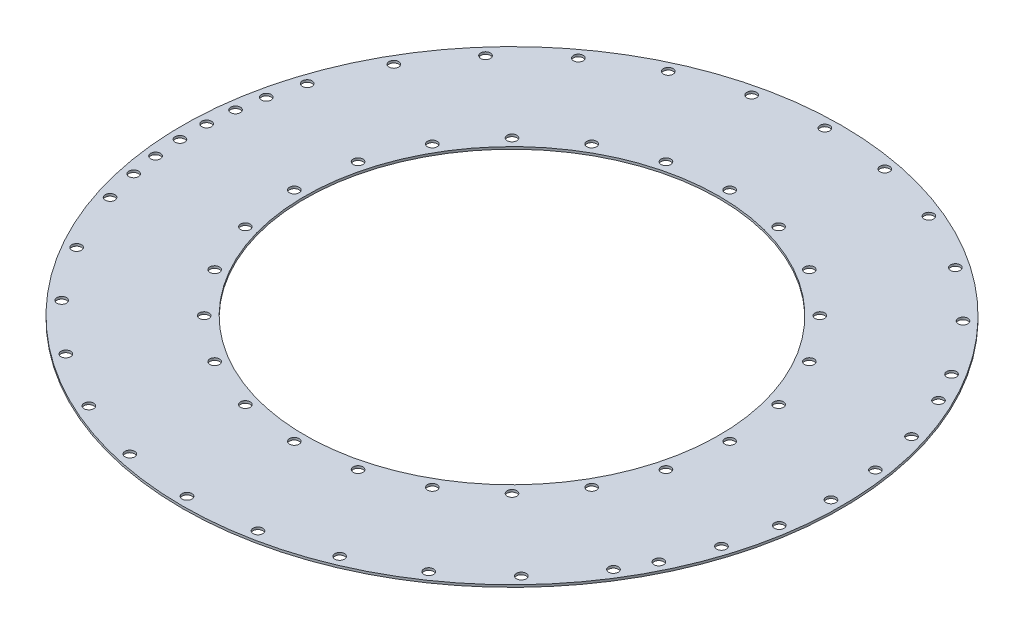
from build123d import *

# Parameters (mm, degrees)
SKETCH1_W             = 40.5
SKETCH1_H             = 0.76
SKETCH2_R             = 1.6
CUT_EXTRUDE1_DEPTH    = 155.151151796
CIRPATTERN1_START     = 6.175
CIRPATTERN1_OUTLINE_R = 1.6
CIRPATTERN1_DEPTH     = 0.76
SKETCH4_R             = 1.6
CUT_EXTRUDE3_DEPTH    = 155.151151796


# Read off the part's stored shape, not the designer's step: CirPattern1
with BuildPart() as part:
    # Sketch1 → Revolve1 (revolve)
    with BuildSketch(Plane.XY, mode=Mode.PRIVATE) as revolve1_sk:
        with Locations((-88.75, 6.555)):
            Rectangle(SKETCH1_W, SKETCH1_H)
    revolve(revolve1_sk.sketch.rotate(Axis((0, -200069.047495165, 0), (0, 1, 0)), 270), axis=Axis((0, -200069.047495165, 0), (0, 1, 0)))

    # Sketch2 → Cut-Extrude1 (cut, through all)
    with BuildSketch(Plane(origin=(0, 6.935, 0), x_dir=(1, 0, 0), z_dir=(0, 1, 0))):
        with Locations(Location((0, 72, 0), (0, 0, 270))):
            Circle(SKETCH2_R)
    extrude(amount=-CUT_EXTRUDE1_DEPTH, mode=Mode.SUBTRACT)

    # CirPattern1 outline → CirPattern1 (cut)
    with BuildSketch(Plane(origin=(0, 0, 0), x_dir=(1, 0, 0), z_dir=(0, 1, 0)).offset(CIRPATTERN1_START)):
        with Locations((18.634971247, 69.546659493)):
            Circle(CIRPATTERN1_OUTLINE_R)
        with Locations((-18.634971247, 69.546659493)):
            Circle(CIRPATTERN1_OUTLINE_R)
        with Locations((-36, 62.353829072)):
            Circle(CIRPATTERN1_OUTLINE_R)
        with Locations((-50.911688245, 50.911688245)):
            Circle(CIRPATTERN1_OUTLINE_R)
        with Locations((-62.353829072, 36)):
            Circle(CIRPATTERN1_OUTLINE_R)
        with Locations((-69.546659493, 18.634971247)):
            Circle(CIRPATTERN1_OUTLINE_R)
        with Locations((-72, 0)):
            Circle(CIRPATTERN1_OUTLINE_R)
        with Locations((36, 62.353829072)):
            Circle(CIRPATTERN1_OUTLINE_R)
        with Locations((50.911688245, 50.911688245)):
            Circle(CIRPATTERN1_OUTLINE_R)
        with Locations((62.353829072, 36)):
            Circle(CIRPATTERN1_OUTLINE_R)
        with Locations((69.546659493, 18.634971247)):
            Circle(CIRPATTERN1_OUTLINE_R)
        with Locations((72, 0)):
            Circle(CIRPATTERN1_OUTLINE_R)
        with Locations((69.546659493, -18.634971247)):
            Circle(CIRPATTERN1_OUTLINE_R)
        with Locations((62.353829072, -36)):
            Circle(CIRPATTERN1_OUTLINE_R)
        with Locations((50.911688245, -50.911688245)):
            Circle(CIRPATTERN1_OUTLINE_R)
        with Locations((36, -62.353829072)):
            Circle(CIRPATTERN1_OUTLINE_R)
        with Locations((18.634971247, -69.546659493)):
            Circle(CIRPATTERN1_OUTLINE_R)
        with Locations((0, -72)):
            Circle(CIRPATTERN1_OUTLINE_R)
        with Locations((-18.634971247, -69.546659493)):
            Circle(CIRPATTERN1_OUTLINE_R)
        with Locations((-36, -62.353829072)):
            Circle(CIRPATTERN1_OUTLINE_R)
        with Locations((-50.911688245, -50.911688245)):
            Circle(CIRPATTERN1_OUTLINE_R)
        with Locations((-62.353829072, -36)):
            Circle(CIRPATTERN1_OUTLINE_R)
        with Locations((-69.546659493, -18.634971247)):
            Circle(CIRPATTERN1_OUTLINE_R)
    extrude(amount=CIRPATTERN1_DEPTH, mode=Mode.SUBTRACT)

    # Sketch4 → Cut-Extrude3 (cut, through all)
    with BuildSketch(Plane(origin=(0, 6.935, 0), x_dir=(1, 0, 0), z_dir=(0, 1, 0))):
        with Locations(Location((-103.194571877, -21.934683381, 0), (0, 0, 270))):
            Circle(SKETCH4_R)
        with Locations(Location((-105.407458575, -4.417881468, 0), (0, 0, 270))):
            Circle(SKETCH4_R)
        with Locations(Location((-104.668100989, -13.222656141, 0), (0, 0, 270))):
            Circle(SKETCH4_R)
        with Locations(Location((-100.336462469, 32.601292907, 0), (0, 0, 270))):
            Circle(SKETCH4_R)
        with Locations(Location((104.295371407, 15.897342642, 0), (0, 0, 270))):
            Circle(SKETCH4_R)
        with Locations(Location((100.708995202, 31.43164465, 0), (0, 0, 270))):
            Circle(SKETCH4_R)
        with Locations(Location((94.822771885, 46.248155986, 0), (0, 0, 270))):
            Circle(SKETCH4_R)
        with Locations(Location((-103.194571877, 21.934683381, 0), (0, 0, 270))):
            Circle(SKETCH4_R)
        with Locations(Location((-104.668100989, 13.222656141, 0), (0, 0, 270))):
            Circle(SKETCH4_R)
        with Locations(Location((-105.407458575, 4.417881468, 0), (0, 0, 270))):
            Circle(SKETCH4_R)
        with Locations(Location((89.469074145, -55.906482377, 0), (0, 0, 270))):
            Circle(SKETCH4_R)
        with Locations(Location((-44.130594647, 95.826617472, 0), (0, 0, 270))):
            Circle(SKETCH4_R)
        with Locations(Location((-62.82106423, 84.757087545, 0), (0, 0, 270))):
            Circle(SKETCH4_R)
        with Locations(Location((-78.848228037, 70.094271773, 0), (0, 0, 270))):
            Circle(SKETCH4_R)
        with Locations(Location((-91.532612735, 52.45980181, 0), (0, 0, 270))):
            Circle(SKETCH4_R)
        with Locations(Location((94.822771885, -46.248155986, 0), (0, 0, 270))):
            Circle(SKETCH4_R)
        with Locations(Location((100.708995202, -31.43164465, 0), (0, 0, 270))):
            Circle(SKETCH4_R)
        with Locations(Location((104.295371407, -15.897342642, 0), (0, 0, 270))):
            Circle(SKETCH4_R)
        with Locations(Location((105.5, 0, 0), (0, 0, 270))):
            Circle(SKETCH4_R)
        with Locations(Location((76.122528254, -73.04526468, 0), (0, 0, 270))):
            Circle(SKETCH4_R)
        with Locations(Location((89.469074145, 55.906482377, 0), (0, 0, 270))):
            Circle(SKETCH4_R)
        with Locations(Location((76.122528254, 73.04526468, 0), (0, 0, 270))):
            Circle(SKETCH4_R)
        with Locations(Location((59.54875959, 87.08728513, 0), (0, 0, 270))):
            Circle(SKETCH4_R)
        with Locations(Location((40.450414858, 97.437230758, 0), (0, 0, 270))):
            Circle(SKETCH4_R)
        with Locations(Location((19.637170436, 103.656314507, 0), (0, 0, 270))):
            Circle(SKETCH4_R)
        with Locations(Location((-2.008593938, 105.480877653, 0), (0, 0, 270))):
            Circle(SKETCH4_R)
        with Locations(Location((-23.569203757, 102.833567643, 0), (0, 0, 270))):
            Circle(SKETCH4_R)
        with Locations(Location((-91.532612735, -52.45980181, 0), (0, 0, 270))):
            Circle(SKETCH4_R)
        with Locations(Location((-62.82106423, -84.757087545, 0), (0, 0, 270))):
            Circle(SKETCH4_R)
        with Locations(Location((-44.130594647, -95.826617472, 0), (0, 0, 270))):
            Circle(SKETCH4_R)
        with Locations(Location((-23.569203757, -102.833567643, 0), (0, 0, 270))):
            Circle(SKETCH4_R)
        with Locations(Location((-2.008593938, -105.480877653, 0), (0, 0, 270))):
            Circle(SKETCH4_R)
        with Locations(Location((19.637170436, -103.656314507, 0), (0, 0, 270))):
            Circle(SKETCH4_R)
        with Locations(Location((40.450414858, -97.437230758, 0), (0, 0, 270))):
            Circle(SKETCH4_R)
        with Locations(Location((59.54875959, -87.08728513, 0), (0, 0, 270))):
            Circle(SKETCH4_R)
        with Locations(Location((-78.848228037, -70.094271773, 0), (0, 0, 270))):
            Circle(SKETCH4_R)
        with Locations(Location((-100.336462469, -32.601292907, 0), (0, 0, 270))):
            Circle(SKETCH4_R)
    extrude(amount=-CUT_EXTRUDE3_DEPTH, mode=Mode.SUBTRACT)


solid = part.part
